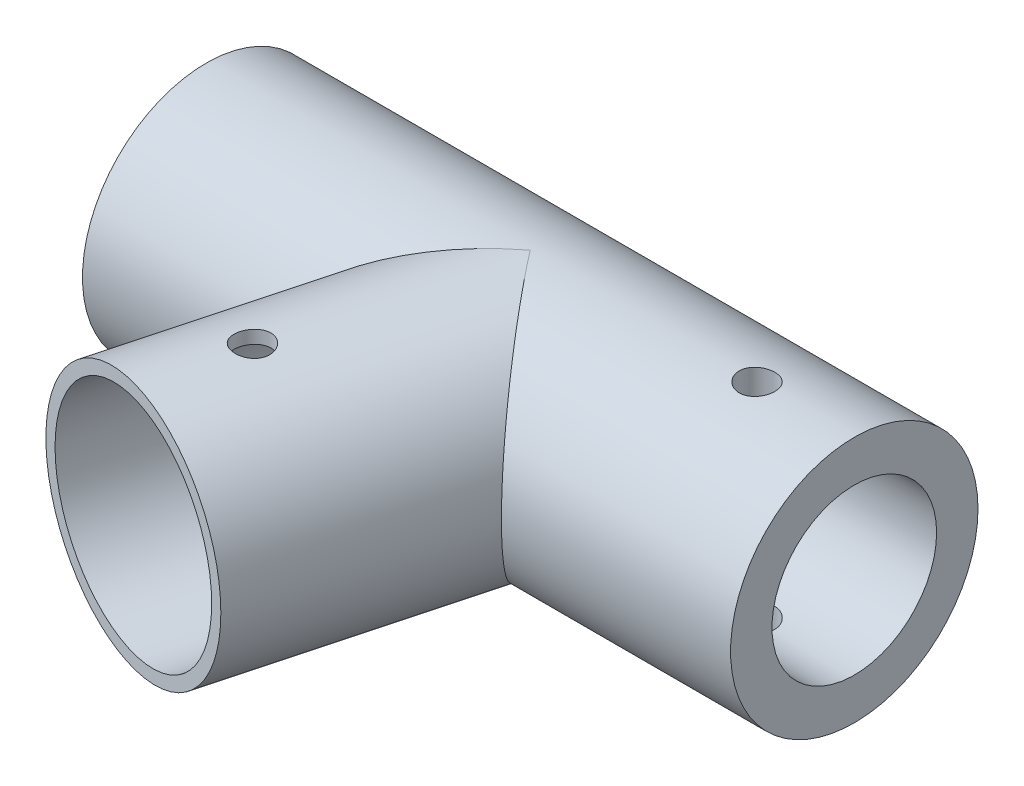
from build123d import *

# Parameters (mm, degrees)
SKETCH2_R                     = 19.0875
BOSS_EXTRUDE1_DEPTH           = 100
BOSS_EXTRUDE2_REACH           = 96.162
BOSS_EXTRUDE2_END_RADIUS      = 19.0875
SKETCH3_R                     = 19.0875
SHELL1_OUTLINE_R              = 17.0875
SHELL1_DEPTH                  = 100
SHELL1_START                  = -37.059047745
SHELL1_2_OUTLINE_R            = 17.0875
SHELL1_2_DEPTH                = 50.0000001
SKETCH8_R                     = 17.0875
SKETCH8_R_2                   = 12.7
BOSS_EXTRUDE3_DEPTH           = 100
SKETCH6_W                     = 2.75
SKETCH6_H                     = 19.0875
M5_CLEARANCE_HOLE1_AT_2_COUNT = 2
M5_CLEARANCE_HOLE1_AT_2_PITCH = 55.53473382
MIRROR1_COPY_1_SKETCH_W       = 2.75
MIRROR1_COPY_1_SKETCH_H       = 19.0875


with BuildPart() as part:
    # Sketch2 → Boss-Extrude1 (new body)
    with BuildSketch(Plane(origin=(0, 0, 0), x_dir=(0, 0, -1), z_dir=(1, 0, 0))):
        Circle(SKETCH2_R)
    extrude(amount=BOSS_EXTRUDE1_DEPTH)

    # Boss-Extrude2: up to this cylinder (the profile starts outside it)
    boss_extrude2_end = Plane(origin=(37.059048, 0, 0), z_dir=(-1, 0, 0)) * Cylinder(BOSS_EXTRUDE2_END_RADIUS, 231.499, mode=Mode.PRIVATE)
    # Sketch3 → Boss-Extrude2 (add, up to the surface)
    with BuildSketch(Plane(origin=(37.059047745, 0, 48.296291314), x_dir=(0.9659258262890673, 0, 0.2588190451025246), z_dir=(-0.2588190451025246, 0, 0.9659258262890673)), mode=Mode.PRIVATE) as boss_extrude2_sk1:
        Circle(SKETCH3_R)
    boss_extrude2_tool1 = extrude(boss_extrude2_sk1.sketch, amount=-BOSS_EXTRUDE2_REACH, mode=Mode.PRIVATE) - boss_extrude2_end
    add(boss_extrude2_tool1.solids().sort_by_distance((37.059048, 0, 48.296291))[0])

    # Shell1: read off the stored shape, not the designer's step
    # Shell1 outline → Shell1 (cut)
    with BuildSketch(Plane.YZ):
        Circle(SHELL1_OUTLINE_R)
    extrude(amount=SHELL1_DEPTH, mode=Mode.SUBTRACT)

    # Shell1 2 outline → Shell1 2 (cut)
    with BuildSketch(Plane(origin=(0, 0, 0), x_dir=(0.9659258262890672, 0, 0.2588190451025251), z_dir=(0.25881904510252507, 0, -0.9659258262890672)).offset(SHELL1_START)):
        with Locations((48.296291314, 0)):
            Circle(SHELL1_2_OUTLINE_R)
    extrude(amount=SHELL1_2_DEPTH, mode=Mode.SUBTRACT)

    # Sketch8 → Boss-Extrude3 (add, through all)
    with BuildSketch(Plane(origin=(100, 0, 0), x_dir=(0, 0, -1), z_dir=(1, 0, 0))):
        Circle(SKETCH8_R)
        Circle(SKETCH8_R_2, mode=Mode.SUBTRACT)
    extrude(amount=-BOSS_EXTRUDE3_DEPTH)

    # Sketch6 → M5 Clearance Hole1 (revolve, cut)
    with BuildSketch(Plane(origin=(85, 0, 0), x_dir=(0, 0, -1), z_dir=(1, 0, 0))):
        with Locations((1.375, 9.54375)):
            Rectangle(SKETCH6_W, SKETCH6_H)
    m5_clearance_hole1 = revolve(axis=Axis((85, -6.35, 0), (0, 1, 0)), mode=Mode.SUBTRACT)

    # M5 Clearance Hole1 at 2: M5 Clearance Hole1 ×2
    with Locations(*[Vector(-0.7933533402912365, 0, 0.608761429008719) * (i * M5_CLEARANCE_HOLE1_AT_2_PITCH) for i in range(1, M5_CLEARANCE_HOLE1_AT_2_COUNT)]):
        add(m5_clearance_hole1, mode=Mode.SUBTRACT)

    # Mirror1: M5 Clearance Hole1 across plane
    add(m5_clearance_hole1.mirror(Plane.ZX), mode=Mode.SUBTRACT)

    # Mirror1 copy 1 sketch → Mirror1 copy 1 (revolve, cut)
    with BuildSketch(Plane(origin=(40.941333421, 0, 33.80740392), x_dir=(0, 0, -1), z_dir=(1, 0, 0))):
        with Locations((1.375, -9.54375)):
            Rectangle(MIRROR1_COPY_1_SKETCH_W, MIRROR1_COPY_1_SKETCH_H)
    revolve(axis=Axis((40.941333421, 6.35, 33.80740392), (0, 1, 0)), mode=Mode.SUBTRACT)


solid = part.part
